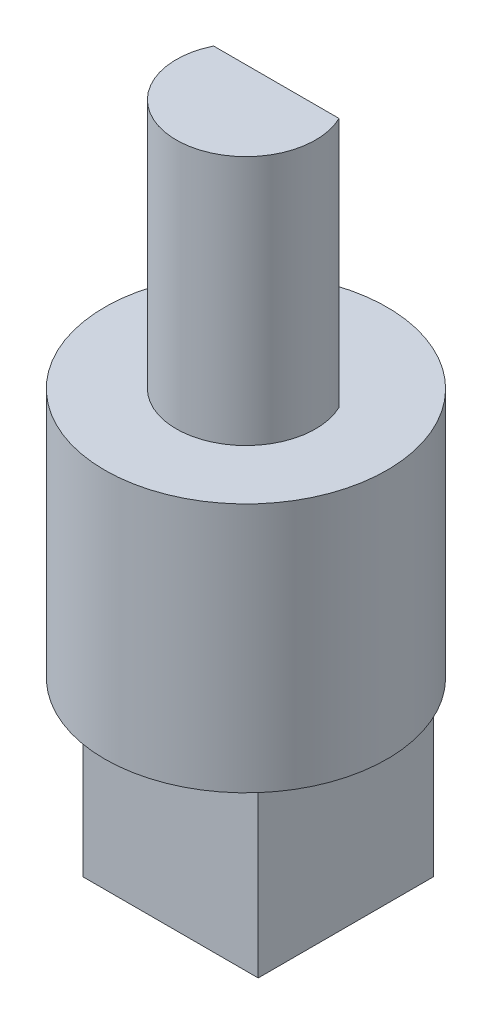
from build123d import *

# Parameters (mm, degrees)
SKETCH1_W           = 4.9
SKETCH1_H           = 4.9
BOSS_EXTRUDE1_DEPTH = 5
SKETCH2_R           = 3.95
BOSS_EXTRUDE2_DEPTH = 7
SKETCH3_R           = 1.95
BOSS_EXTRUDE3_DEPTH = 7
CUT_EXTRUDE1_START  = -7
CUT_EXTRUDE1_DEPTH  = 7


with BuildPart() as part:
    # Sketch1 → Boss-Extrude1 (new body)
    with BuildSketch(Plane(origin=(0, 0, 0), x_dir=(1, 0, 0), z_dir=(0, 1, 0))):
        with Locations((0, 0.343071786)):
            Rectangle(SKETCH1_W, SKETCH1_H)
    extrude(amount=BOSS_EXTRUDE1_DEPTH)

    # Sketch2 → Boss-Extrude2 (add)
    with BuildSketch(Plane(origin=(0, 5, 0), x_dir=(1, 0, 0), z_dir=(0, 1, 0))):
        Circle(SKETCH2_R)
    extrude(amount=BOSS_EXTRUDE2_DEPTH)

    # Sketch3 → Boss-Extrude3 (add)
    with BuildSketch(Plane(origin=(0, 12, 0), x_dir=(1, 0, 0), z_dir=(0, 1, 0))):
        Circle(SKETCH3_R)
    extrude(amount=BOSS_EXTRUDE3_DEPTH)

    # Sketch4 → Cut-Extrude1 (cut)
    with BuildSketch(Plane(origin=(0, 19, 0), x_dir=(1, 0, 0), z_dir=(0, 1, 0)).offset(CUT_EXTRUDE1_START)):
        with BuildLine():
            Line((-1.754992877, 0.85), (1.754992877, 0.85))
            ThreePointArc((1.754992877, 0.85), (0, 1.95), (-1.754992877, 0.85))
        make_face()
    extrude(amount=CUT_EXTRUDE1_DEPTH, mode=Mode.SUBTRACT)


solid = part.part
